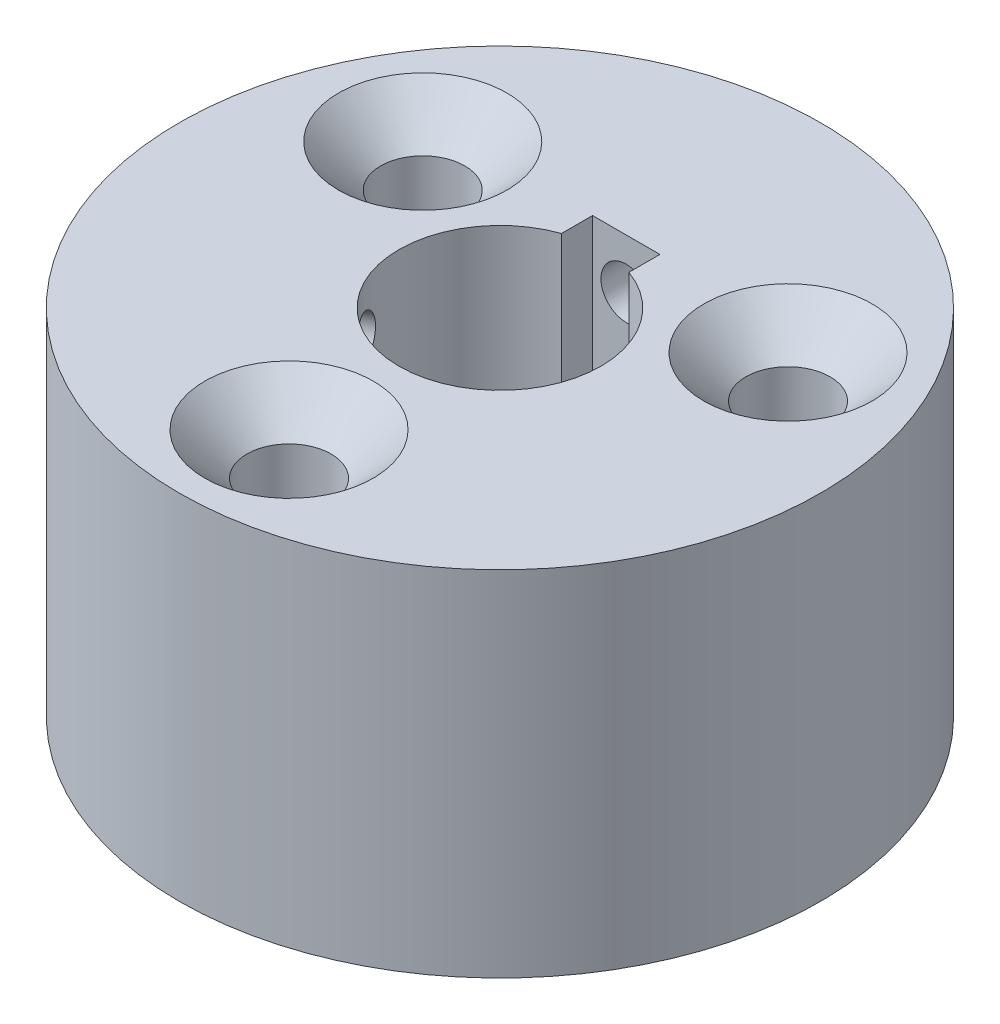
from build123d import *

# Parameters (mm, degrees)
SKETCH1_R               = 19.05
SKETCH1_R_2             = 2.5
BOSS_EXTRUDE1_DEPTH     = 21
CUT_EXTRUDE1_DEPTH      = 3
CUT_EXTRUDE1_DEPTH_BACK = 15
SKETCH2_R               = 1.5
SKETCH4_R               = 1.5
CUT_EXTRUDE2_DEPTH      = 20
CHAMFER1_SIZE           = 2.5


with BuildPart() as part:
    # Sketch1 → Boss-Extrude1 (new body)
    with BuildSketch(Plane(origin=(0, 0, 0), x_dir=(1, 0, 0), z_dir=(0, 1, 0))):
        Circle(SKETCH1_R)
        with Locations((0, -12.525)):
            Circle(SKETCH1_R_2, mode=Mode.SUBTRACT)
        with Locations((-10.846968182, 6.2625)):
            Circle(SKETCH1_R_2, mode=Mode.SUBTRACT)
        with BuildLine():
            Line((-2, 5.656854249), (-2, 7.5))
            Line((-2, 7.5), (-1, 7.5))
            Line((-1, 7.5), (1, 7.5))
            Line((1, 7.5), (2, 7.5))
            Line((2, 7.5), (2, 5.656854249))
            ThreePointArc((2, 5.656854249), (4.898979486, 3.464101615), (6, 0))
            ThreePointArc((6, 0), (-3.464101615, -4.898979486), (-2, 5.656854249))
        make_face(mode=Mode.SUBTRACT)
        with Locations((10.846968182, 6.2625)):
            Circle(SKETCH1_R_2, mode=Mode.SUBTRACT)
    extrude(amount=BOSS_EXTRUDE1_DEPTH)

    # Sketch2 → Cut-Extrude1 (cut, two sides: drawn at the far end of the back side and taken through both)
    with BuildSketch(Plane.XY.offset(-7.5).offset(-CUT_EXTRUDE1_DEPTH_BACK)):
        with Locations((0, 18)):
            Circle(SKETCH2_R)
    extrude(amount=CUT_EXTRUDE1_DEPTH + CUT_EXTRUDE1_DEPTH_BACK, mode=Mode.SUBTRACT)

    # Sketch4 → Cut-Extrude2 (cut)
    with BuildSketch(Plane(origin=(0, 0, 0), x_dir=(0, -1, 0), z_dir=(-0.8660254037844397, 0, 0.49999999999999817))):
        with Locations((-18, 0)):
            Circle(SKETCH4_R)
    extrude(amount=CUT_EXTRUDE2_DEPTH, mode=Mode.SUBTRACT)

    # Chamfer1
    chamfer1_edges = [part.edges().sort_by_distance(p)[0] for p in [
        (-2.5, 21, 12.525),
        (-13.346968182, 21, -6.2625),
        (8.346968182, 21, -6.2625),
    ]]
    chamfer(chamfer1_edges, length=CHAMFER1_SIZE)


solid = part.part
